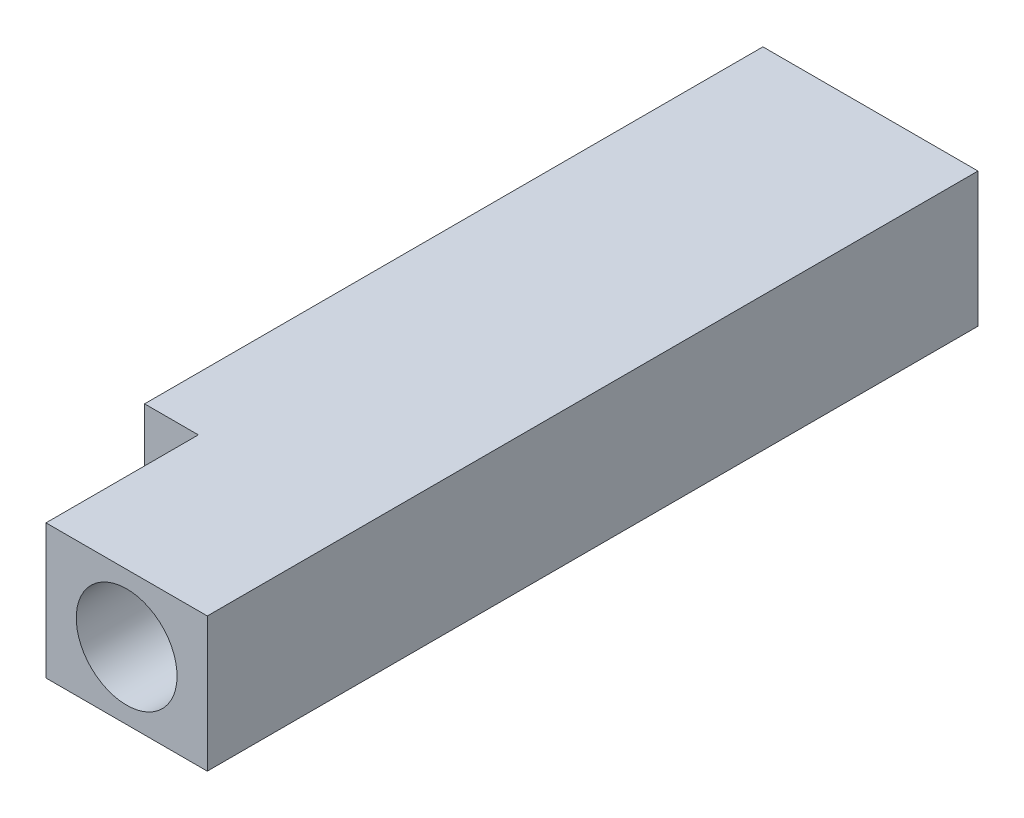
from build123d import *

# Parameters (mm, degrees)
SKETCH1_W           = 38.1
SKETCH1_H           = 19.05
BOSS_EXTRUDE1_DEPTH = 114.3
SKETCH3_R           = 5.1054
CUT_EXTRUDE2_DEPTH  = 109.785341499
CUT_EXTRUDE3_REACH  = 122.859
SKETCH4_R           = 4.445
SKETCH5_R           = 7.14375
CUT_EXTRUDE4_DEPTH  = 20.066
SKETCH1_3_W         = 38.1
SKETCH1_3_H         = 19.05
CUT_EXTRUDE7_DEPTH  = 5.08
SKETCH15_W          = 109.22
SKETCH15_H          = 19.05
CUT_EXTRUDE8_DEPTH  = 7.62
SKETCH17_W          = 21.59
SKETCH17_H          = 19.05
CUT_EXTRUDE9_DEPTH  = 7.62


with BuildPart() as part:
    # Sketch1 → Boss-Extrude1 (new body)
    with BuildSketch(Plane.XY):
        Rectangle(SKETCH1_W, SKETCH1_H)
    extrude(amount=BOSS_EXTRUDE1_DEPTH)

    # Sketch3 → Cut-Extrude2 (cut, through all)
    with BuildSketch(Plane(origin=(0, 0, 7.62), x_dir=(-1, 0, 0), z_dir=(0, 0, -1))):
        Circle(SKETCH3_R)
    extrude(amount=-CUT_EXTRUDE2_DEPTH, mode=Mode.SUBTRACT)

    # Sketch4 → Cut-Extrude3 (cut, up to next)
    with BuildSketch(Plane.ZY.offset(19.05), mode=Mode.PRIVATE) as cut_extrude3_sk1:
        with Locations((16.5354, 0)):
            Circle(SKETCH4_R)
    cut_extrude3_tool1 = extrude(cut_extrude3_sk1.sketch, amount=-CUT_EXTRUDE3_REACH, mode=Mode.PRIVATE) & part.part
    # Sketch4 → Cut-Extrude3 (cut, up to next)
    with BuildSketch(Plane.ZY.offset(19.05), mode=Mode.PRIVATE) as cut_extrude3_sk2:
        with Locations((33.0454, 0)):
            Circle(SKETCH4_R)
    cut_extrude3_tool2 = extrude(cut_extrude3_sk2.sketch, amount=-CUT_EXTRUDE3_REACH, mode=Mode.PRIVATE) & part.part
    # Sketch4 → Cut-Extrude3 (cut, up to next)
    with BuildSketch(Plane.ZY.offset(19.05), mode=Mode.PRIVATE) as cut_extrude3_sk3:
        with Locations((49.5554, 0)):
            Circle(SKETCH4_R)
    cut_extrude3_tool3 = extrude(cut_extrude3_sk3.sketch, amount=-CUT_EXTRUDE3_REACH, mode=Mode.PRIVATE) & part.part
    # Sketch4 → Cut-Extrude3 (cut, up to next)
    with BuildSketch(Plane.ZY.offset(19.05), mode=Mode.PRIVATE) as cut_extrude3_sk4:
        with Locations((66.0654, 0)):
            Circle(SKETCH4_R)
    cut_extrude3_tool4 = extrude(cut_extrude3_sk4.sketch, amount=-CUT_EXTRUDE3_REACH, mode=Mode.PRIVATE) & part.part
    # Sketch4 → Cut-Extrude3 (cut, up to next)
    with BuildSketch(Plane.ZY.offset(19.05), mode=Mode.PRIVATE) as cut_extrude3_sk5:
        with Locations((82.5754, 0)):
            Circle(SKETCH4_R)
    cut_extrude3_tool5 = extrude(cut_extrude3_sk5.sketch, amount=-CUT_EXTRUDE3_REACH, mode=Mode.PRIVATE) & part.part
    add(cut_extrude3_tool1.solids().sort_by_distance((-19.05, 0, 16.5354))[0], mode=Mode.SUBTRACT)
    add(cut_extrude3_tool2.solids().sort_by_distance((-19.05, 0, 33.0454))[0], mode=Mode.SUBTRACT)
    add(cut_extrude3_tool3.solids().sort_by_distance((-19.05, 0, 49.5554))[0], mode=Mode.SUBTRACT)
    add(cut_extrude3_tool4.solids().sort_by_distance((-19.05, 0, 66.0654))[0], mode=Mode.SUBTRACT)
    add(cut_extrude3_tool5.solids().sort_by_distance((-19.05, 0, 82.5754))[0], mode=Mode.SUBTRACT)

    # Sketch5 → Cut-Extrude4 (cut)
    with BuildSketch(Plane.XY.offset(114.3)):
        Circle(SKETCH5_R)
    extrude(amount=-CUT_EXTRUDE4_DEPTH, mode=Mode.SUBTRACT)

    # Sketch1<3> → Cut-Extrude7 (cut)
    with BuildSketch(Plane.XY):
        Rectangle(SKETCH1_3_W, SKETCH1_3_H)
    extrude(amount=CUT_EXTRUDE7_DEPTH, mode=Mode.SUBTRACT)

    # Sketch15 → Cut-Extrude8 (cut)
    with BuildSketch(Plane(origin=(19.05, 0, 0), x_dir=(0, 0, -1), z_dir=(1, 0, 0))):
        with Locations((-59.69, 0)):
            Rectangle(SKETCH15_W, SKETCH15_H)
    extrude(amount=-CUT_EXTRUDE8_DEPTH, mode=Mode.SUBTRACT)

    # Sketch17 → Cut-Extrude9 (cut)
    with BuildSketch(Plane.ZY.offset(19.05)):
        with Locations((103.505, 0)):
            Rectangle(SKETCH17_W, SKETCH17_H)
    extrude(amount=-CUT_EXTRUDE9_DEPTH, mode=Mode.SUBTRACT)


solid = part.part
